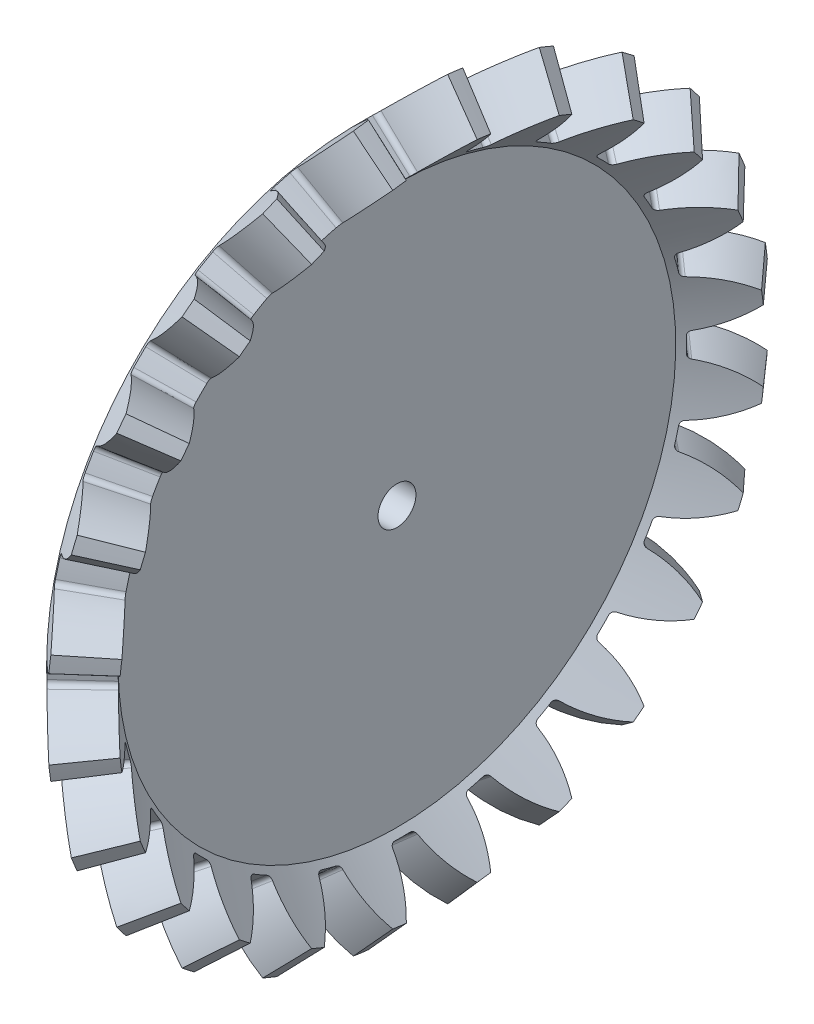
from build123d import *

# Parameters (mm, degrees)
TOOCUTSKE2_R    = 0.0127
TEETHCUTS_COUNT = 24
TEETHCUTS_ANGLE = 345
HUBSKE_R        = 5
HUB_DEPTH       = 0.0001016
BORSKE_R        = 1.5
BORE_DEPTH      = 29.363555216


with BuildPart() as part:
    # BasProSke → Base-Revolve (revolve)
    with BuildSketch(Plane(origin=(0, 0, 0), x_dir=(1, 0, 0), z_dir=(0, 1, 0))):
        Polygon((0, 0), (0, 24.636495586), (3.954494677, 28.590990256), (6.616255133, 25.595896462), (3.076019715, 22.055661051), (3.076019715, 0), align=None)
    revolve(axis=Axis((-10, 0, 0), (1, 0, 0)))

    # TooCutSke2 → ToothCut section 0
    with BuildSketch(Plane(origin=(14.681752183, -14.681752209, 0), x_dir=(0, 0, 1), z_dir=(-0.7071067805519597, 0.7071067818211354, 0))):
        with Locations((0, 20.763133078)):
            Circle(TOOCUTSKE2_R)
    # TooCutSke → ToothCut section 1
    with BuildSketch(Plane(origin=(1.977247339, 26.613742921, 0), x_dir=(0, 0, -1), z_dir=(-0.70710678055196, 0.7071067818211351, 0))):
        with BuildLine():
            ThreePointArc((-3.543432931, -3.170080071), (0, -3.38125), (3.543432931, -3.170080071))
            ThreePointArc((3.543432931, -3.170080071), (1.994806598, -0.846320605), (1.09374962, 1.796821067))
            ThreePointArc((1.09374962, 1.796821067), (0.94215301, 2.04478949), (0.666492312, 2.13688211))
            ThreePointArc((0.666492312, 2.13688211), (0, 2.12775), (-0.666492312, 2.13688211))
            ThreePointArc((-0.666492312, 2.13688211), (-0.94215301, 2.04478949), (-1.09374962, 1.796821067))
            ThreePointArc((-1.09374962, 1.796821067), (-1.994806598, -0.846320605), (-3.543432931, -3.170080071))
        make_face()
    toothcut = loft(mode=Mode.SUBTRACT)

    # TeethCuts: ToothCut ×24 about axis
    teethcuts_axis = Axis((-10, 0, 0), (1, 0, 0))
    for i in range(1, TEETHCUTS_COUNT):
        add(toothcut.rotate(teethcuts_axis, i * TEETHCUTS_ANGLE / (TEETHCUTS_COUNT - 1)), mode=Mode.SUBTRACT)

    # HubSke → Hub (add)
    with BuildSketch(Plane.ZY):
        Circle(HUBSKE_R)
    extrude(amount=HUB_DEPTH)

    # BorSke → Bore (cut, symmetric)
    with BuildSketch(Plane(origin=(0, 0, 0), x_dir=(0, 0, -1), z_dir=(1, 0, 0))):
        Circle(BORSKE_R)
    extrude(amount=BORE_DEPTH, both=True, mode=Mode.SUBTRACT)


solid = part.part
